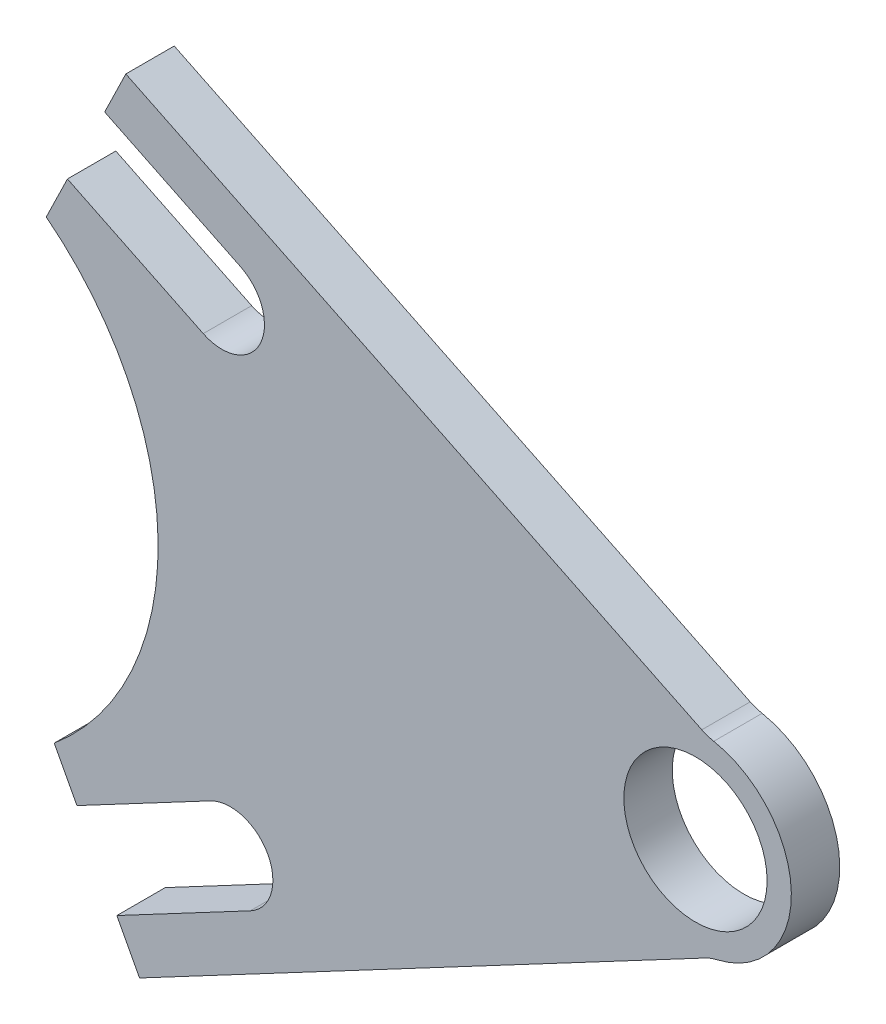
from build123d import *

# Parameters (mm, degrees)
SKETCH1_R           = 12.578
SKETCH1_R_2         = 9.398
BOSS_EXTRUDE1_DEPTH = 3.175
FILLET1_R           = 38.1
FILLET2_R           = 6.35


with BuildPart() as part:
    # Sketch1 → Boss-Extrude1 (new, symmetric)
    # profile 1 of 4: a face of its own
    with BuildSketch(Plane.XY):
        with BuildLine():
            Line((550.906377784, 50.55819174), (568.724608053, 41.896435909))
            ThreePointArc((568.724608053, 41.896435909), (571.307203408, 34.427721881), (563.838489379, 31.845126527))
            Line((563.838489379, 31.845126527), (546.02025911, 40.506882357))
            Line((546.02025911, 40.506882357), (543.244055318, 34.795911117))
            Line((543.244055318, 34.795911117), (602.068897859, 6.200118203))
            Line((602.068897859, 6.200118203), (619.322536705, 15.354662769))
            ThreePointArc((619.322536705, 15.354662769), (624.245533427, 18.531839743), (630.07371037, 19.134088663))
            Line((630.07371037, 19.134088663), (553.682581576, 56.26916298))
            Line((553.682581576, 56.26916298), (550.906377784, 50.55819174))
        make_face()
    # profile 2 of 4: a face of its own
    with BuildSketch(Plane.XY):
        with BuildLine():
            ThreePointArc((619.635184113, -2.3391632), (615.840878926, 6.443467165), (619.322536705, 15.354662769))
            Line((619.322536705, 15.354662769), (602.068897859, 6.200118203))
            Line((602.068897859, 6.200118203), (619.635184113, -2.3391632))
        make_face()
    # profile 3 of 4: a face of its own
    with BuildSketch(Plane.XY):
        with Locations((628.416915809, 6.665683962)):
            Circle(SKETCH1_R)
        with Locations((628.416915809, 6.665683962)):
            Circle(SKETCH1_R_2, mode=Mode.SUBTRACT)
    # profile 4 of 4: a face of its own
    with BuildSketch(Plane.XY):
        with BuildLine():
            Line((619.635184113, -2.3391632), (602.068897859, 6.200118203))
            Line((602.068897859, 6.200118203), (544.291028723, -24.456028169))
            Line((544.291028723, -24.456028169), (547.267260579, -30.065354683))
            Line((547.267260579, -30.065354683), (564.768359303, -20.779511294))
            ThreePointArc((564.768359303, -20.779511294), (572.323650668, -23.096634594), (570.006527369, -30.651925959))
            Line((570.006527369, -30.651925959), (552.505428645, -39.937769348))
            Line((552.505428645, -39.937769348), (555.4816605, -45.547095862))
            Line((555.4816605, -45.547095862), (630.513168482, -5.736404924))
            ThreePointArc((630.513168482, -5.736404924), (624.667353131, -5.3404338), (619.635184113, -2.3391632))
        make_face()
    extrude(amount=BOSS_EXTRUDE1_DEPTH, both=True)

    # Fillet1
    # the kernel refuses this fillet: 38.1 mm, written as the material it adds along each edge
    with BuildSketch(Plane(origin=(602.068897859, 6.200118203, -3.175), x_dir=(-0.8993655496308585, 0.43719744754193623, 0), z_dir=(0, 0, 1))) as fillet1_piece_1:
        with BuildLine():
            CenterArc((73.33595186, 37.265834599), FILLET1_R, 155.886500773, 102.102011478)
            Line((38.560636086, 52.831418843), (0, 0))
            Line((0, 0), (65.407044516, 0))
        make_face()
    extrude(amount=6.35)

    # Fillet2
    fillet2_edges = [part.edges().sort_by_distance(p)[0] for p in [
        (630.07371037, 19.134088663, 0),
        (630.513168482, -5.736404924, 0),
    ]]
    fillet(fillet2_edges, radius=FILLET2_R)


solid = part.part
